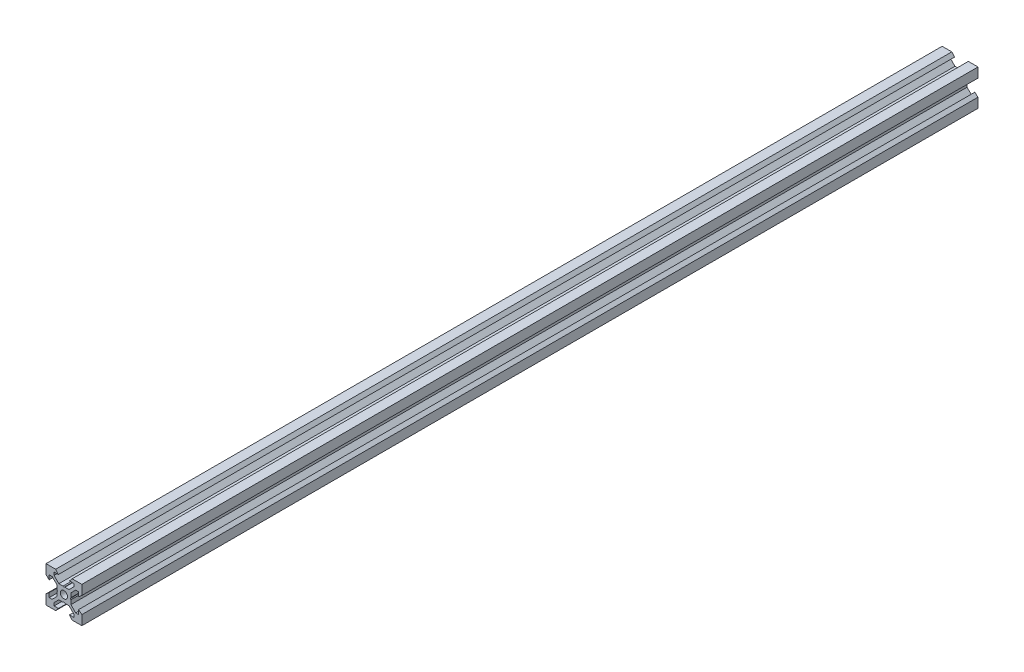
from build123d import *

# Parameters (mm, degrees)
SKETCH1_R           = 2
BOSS_EXTRUDE1_DEPTH = 250


with BuildPart() as part:
    # Sketch1 → Boss-Extrude1 (new, symmetric)
    with BuildSketch(Plane.XY):
        Polygon((10, 4.610379336), (10, 10), (4.610379336, 10), (3.1, 8.2), (5.5, 8.2), (5.5, 6.560660172), (2.839339828, 3.9), (0.519615242, 3.9), (0, 3.6), (-0.519615242, 3.9), (-2.839339828, 3.9), (-5.5, 6.560660172), (-5.5, 8.2), (-3.1, 8.2), (-4.610379336, 10), (-10, 10), (-10, 4.610379336), (-8.2, 3.1), (-8.2, 5.5), (-6.560660172, 5.5), (-3.9, 2.839339828), (-3.9, 0.519615242), (-3.6, 0), (-3.9, -0.519615242), (-3.9, -2.839339828), (-6.560660172, -5.5), (-8.2, -5.5), (-8.2, -3.1), (-10, -4.610379336), (-10, -10), (-4.610379336, -10), (-3.1, -8.2), (-5.5, -8.2), (-5.5, -6.560660172), (-2.839339828, -3.9), (-0.519615242, -3.9), (0, -3.6), (0.519615242, -3.9), (2.839339828, -3.9), (5.5, -6.560660172), (5.5, -8.2), (3.1, -8.2), (4.610379336, -10), (10, -10), (10, -4.610379336), (8.2, -3.1), (8.2, -5.5), (6.560660172, -5.5), (3.9, -2.839339828), (3.9, -0.519615242), (3.6, 0), (3.9, 0.519615242), (3.9, 2.839339828), (6.560660172, 5.5), (8.2, 5.5), (8.2, 3.1), align=None)
        Circle(SKETCH1_R, mode=Mode.SUBTRACT)
    extrude(amount=BOSS_EXTRUDE1_DEPTH, both=True)


solid = part.part
